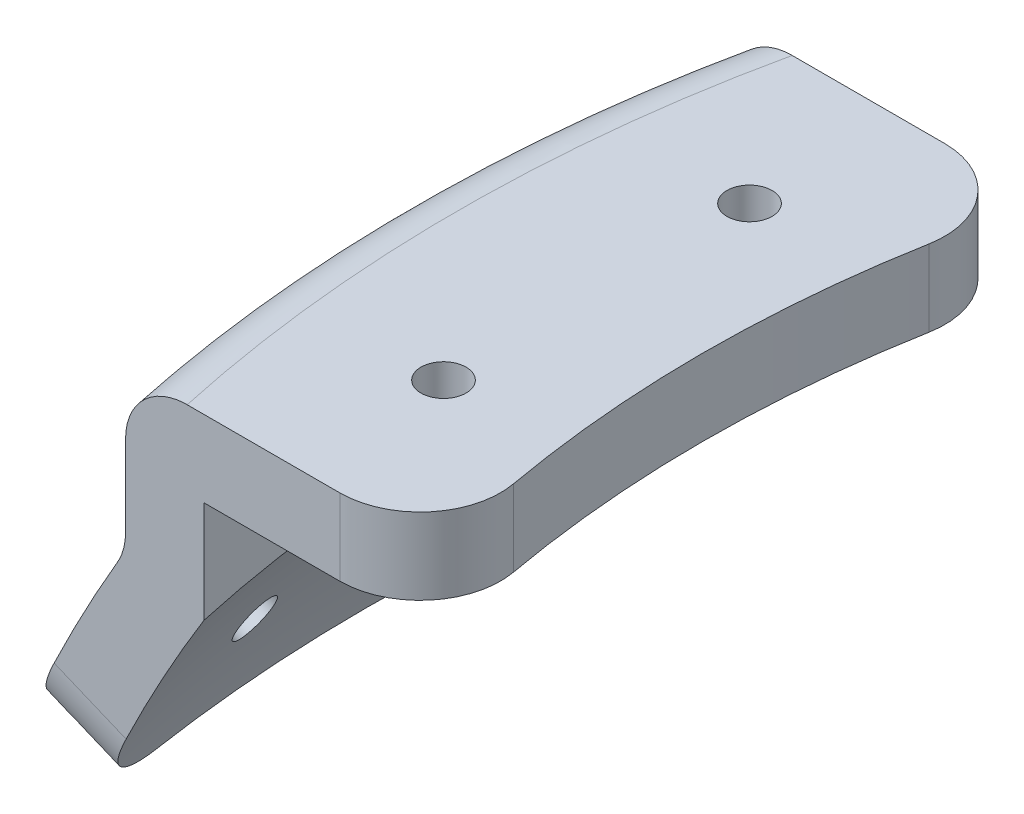
from build123d import *

# Parameters (mm, degrees)
REVOLVE1_ANGLE          = 30
FILLET1_R               = 7.5
CUT_EXTRUDE1_DEPTH      = 207.295163461
CUT_EXTRUDE1_DEPTH_BACK = 207.295163461
SKETCH3_R               = 2.805
SKETCH4_OUTSIDE_W       = 82.664
SKETCH4_OUTSIDE_H       = 128.62
SKETCH4_OUTSIDE_W_2     = 74.859969382
SKETCH4_OUTSIDE_H_2     = 75.329921726
CUT_EXTRUDE2_DEPTH      = 209.298230862
FILLET2_R               = 10


with BuildPart() as part:
    # Sketch2 → Revolve1 (revolve, symmetric)
    with BuildSketch(Plane.XY) as revolve1_sk:
        with BuildLine():
            Line((-196.144484664, 172.22408059), (-187.361895799, 168.537380464))
            ThreePointArc((-187.361895799, 168.537380464), (-181.203221282, 181.842291517), (-174.101233777, 194.668503093))
            Line((-174.101233777, 194.668503093), (-174.101233777, 207.368503093))
            Line((-174.101233777, 207.368503093), (-145.526233777, 207.368503093))
            Line((-145.526233777, 207.368503093), (-145.526233777, 216.893503093))
            Line((-145.526233777, 216.893503093), (-183.626233777, 216.893503093))
            Line((-183.626233777, 216.893503093), (-183.626233777, 197.281129034))
            ThreePointArc((-183.626233777, 197.281129034), (-190.298222707, 184.958867282), (-196.144484664, 172.22408059))
        make_face()
    revolve(axis=Axis((0, 0, 0), (0, 1, 0)), revolution_arc=REVOLVE1_ANGLE / 2)
    revolve(revolve1_sk.sketch, axis=Axis((0, 0, 0), (0, -1, 0)), revolution_arc=REVOLVE1_ANGLE / 2)

    # Fillet1
    fillet1_edges = [part.edges().sort_by_distance(p)[0] for p in [
        (-183.626233777, 197.281129034, 0),
        (-183.626233777, 216.893503093, 0),
    ]]
    fillet(fillet1_edges, radius=FILLET1_R)

    # Sketch3 → Cut-Extrude1 (cut, two sides: drawn at the far end of the back side and taken through both)
    with BuildSketch(Plane.XZ.offset(-207.368503093).offset(-CUT_EXTRUDE1_DEPTH_BACK)):
        with Locations((-158.75, -19.05)):
            Circle(SKETCH3_R)
        with Locations((-158.75, 19.05)):
            Circle(SKETCH3_R)
    extrude(amount=CUT_EXTRUDE1_DEPTH + CUT_EXTRUDE1_DEPTH_BACK, mode=Mode.SUBTRACT)

    # Sketch4 outside → Cut-Extrude2 (cut, through all)
    with BuildSketch(Plane(origin=(0, 216.893503093, 0), x_dir=(1, 0, 0), z_dir=(0, 1, 0))):
        with Locations((-168.356, 0)):
            Rectangle(SKETCH4_OUTSIDE_W, SKETCH4_OUTSIDE_H)
        with Locations((-177.997532298, 0)):
            Rectangle(SKETCH4_OUTSIDE_W_2, SKETCH4_OUTSIDE_H_2, mode=Mode.SUBTRACT)
    extrude(amount=-CUT_EXTRUDE2_DEPTH, mode=Mode.SUBTRACT)

    # Fillet2
    fillet2_edges = [part.edges().sort_by_distance(p)[0] for p in [
        (-188.015889107, 170.380005777, 37.664960863),
        (-188.015889107, 170.380005777, -37.664960863),
        (-140.567547607, 212.131003093, -37.664960863),
        (-140.567547607, 212.131003093, 37.664960863),
    ]]
    fillet(fillet2_edges, radius=FILLET2_R)

    # Sketch6 → Cut-Revolve1 (revolve, cut)
    with BuildSketch(Plane(origin=(36.360369904, 71.361243959, 0), x_dir=(-0.8910065241883691, 0.4539904997395443, 0), z_dir=(0.4539904997395443, 0.8910065241883691, 0))):
        Polygon((216.837700771, 18.970840643), (271.242197983, 23.730617393), (270.997726125, 26.524943522), (216.593228913, 21.765166771), align=None)
    cut_revolve1 = revolve(axis=Axis((-156.843436173, 169.803500094, 18.970840643), (-0.887615975361608, 0.4522629288245561, 0.08715574274765836)), mode=Mode.SUBTRACT)

    # Mirror1: Cut-Revolve1 across plane
    add(cut_revolve1.mirror(Plane.XY), mode=Mode.SUBTRACT)


solid = part.part
